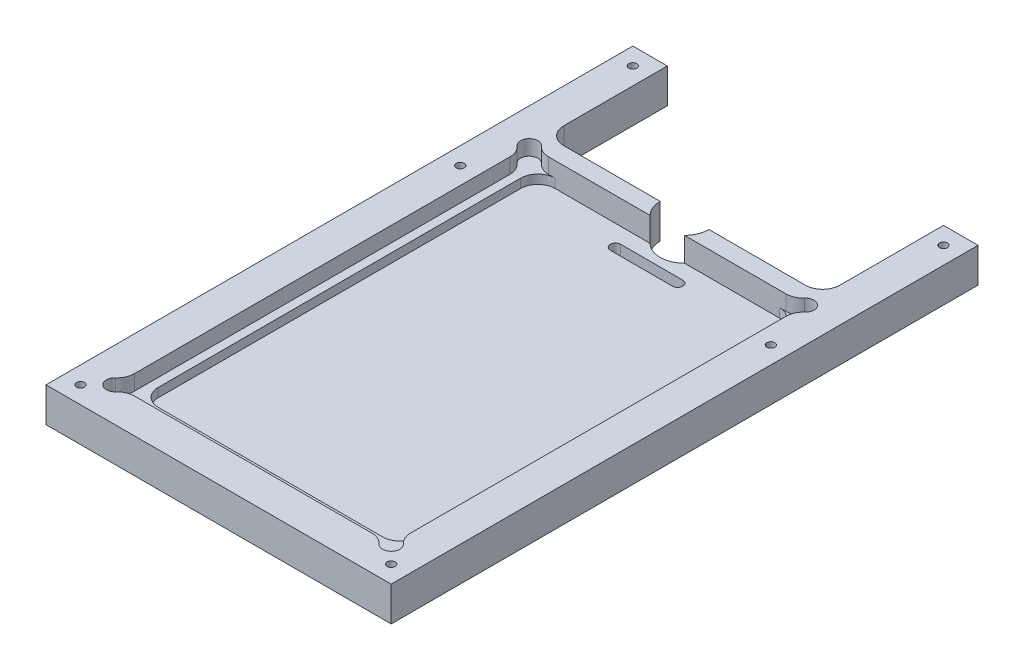
from build123d import *

# Parameters (mm, degrees)
SKETCH2_W                   = 127
SKETCH2_H                   = 215.9
BOSS_EXTRUDE1_DEPTH         = 12.7
SKETCH5_W                   = 101.6
SKETCH5_H                   = 152.4
CUT_EXTRUDE3_DEPTH          = 5.588
SKETCH6_W                   = 101.6
SKETCH6_H                   = 44.45
CUT_EXTRUDE4_DEPTH          = 251.804904258
SKETCH8_R                   = 8.980256121
CUT_EXTRUDE6_DEPTH          = 251.804904258
SKETCH9_W                   = 95.25
SKETCH9_H                   = 146.05
CUT_EXTRUDE7_DEPTH          = 3.302
CUT_EXTRUDE8_DEPTH          = 3.81
F_32_0_116_DIAMETER_HOLE1_D = 2.9464
SKETCH18_R                  = 3.175
CUT_EXTRUDE9_DEPTH          = 5.588
FILLET5_R                   = 6.35
FILLET7_R                   = 6.35
FILLET8_R                   = 6.35
FILLET10_R                  = 6.35
FILLET11_R                  = 6.35


with BuildPart() as part:
    # Sketch2 → Boss-Extrude1 (new body)
    with BuildSketch(Plane(origin=(0, 0, 0), x_dir=(1, 0, 0), z_dir=(0, 1, 0))):
        with Locations((63.5, 107.95)):
            Rectangle(SKETCH2_W, SKETCH2_H)
    extrude(amount=BOSS_EXTRUDE1_DEPTH)

    # Sketch5 → Cut-Extrude3 (cut)
    with BuildSketch(Plane(origin=(0, 12.7, 0), x_dir=(1, 0, 0), z_dir=(0, 1, 0))):
        with Locations((63.5, 88.9)):
            Rectangle(SKETCH5_W, SKETCH5_H)
    extrude(amount=-CUT_EXTRUDE3_DEPTH, mode=Mode.SUBTRACT)

    # Sketch6 → Cut-Extrude4 (cut, through all)
    with BuildSketch(Plane(origin=(0, 12.7, 0), x_dir=(1, 0, 0), z_dir=(0, 1, 0))):
        with Locations((63.5, 193.675)):
            Rectangle(SKETCH6_W, SKETCH6_H)
    extrude(amount=-CUT_EXTRUDE4_DEPTH, mode=Mode.SUBTRACT)

    # Sketch8 → Cut-Extrude6 (cut, through all)
    with BuildSketch(Plane(origin=(0, 12.7, 0), x_dir=(1, 0, 0), z_dir=(0, 1, 0))):
        with Locations((63.5, 171.45)):
            Circle(SKETCH8_R)
    extrude(amount=-CUT_EXTRUDE6_DEPTH, mode=Mode.SUBTRACT)

    # Sketch9 → Cut-Extrude7 (cut)
    with BuildSketch(Plane(origin=(0, 7.112, 0), x_dir=(1, 0, 0), z_dir=(0, 1, 0))):
        with Locations((63.5, 92.075)):
            Rectangle(SKETCH9_W, SKETCH9_H)
    extrude(amount=-CUT_EXTRUDE7_DEPTH, mode=Mode.SUBTRACT)

    # Sketch11 → Cut-Extrude8 (cut)
    with BuildSketch(Plane(origin=(0, 3.81, 0), x_dir=(1, 0, 0), z_dir=(0, 1, 0))):
        with BuildLine():
            Line((74.93, 155.575), (52.07, 155.575))
            ThreePointArc((52.07, 155.575), (50.165, 157.48), (52.07, 159.385))
            Line((52.07, 159.385), (74.93, 159.385))
            ThreePointArc((74.93, 159.385), (76.835, 157.48), (74.93, 155.575))
        make_face()
    extrude(amount=-CUT_EXTRUDE8_DEPTH, mode=Mode.SUBTRACT)

    # #32 (0.116) Diameter Hole1 (through all)
    with Locations(Plane(origin=(0, 12.7, 0), x_dir=(1, 0, 0), z_dir=(0, 1, 0))):
        with Locations((6.35, 209.55), (120.65, 209.55), (120.65, 6.35), (6.35, 6.35), (6.35, 146.05), (120.65, 146.05)):
            Hole(F_32_0_116_DIAMETER_HOLE1_D / 2)

    # Sketch18 → Cut-Extrude9 (cut)
    with BuildSketch(Plane(origin=(0, 12.7, 0), x_dir=(1, 0, 0), z_dir=(0, 1, 0))):
        with Locations((12.7, 165.1)):
            Circle(SKETCH18_R)
        with Locations((114.3, 165.1)):
            Circle(SKETCH18_R)
        with Locations((114.3, 12.7)):
            Circle(SKETCH18_R)
        with Locations((12.7, 12.7)):
            Circle(SKETCH18_R)
    extrude(amount=-CUT_EXTRUDE9_DEPTH, mode=Mode.SUBTRACT)

    # Fillet5
    fillet5_edges = [part.edges().sort_by_distance(p)[0] for p in [
        (12.7, 9.906, -15.875),
        (15.875, 9.906, -12.7),
        (114.3, 9.906, -15.875),
        (111.125, 9.906, -12.7),
        (111.125, 9.906, -165.1),
        (114.3, 9.906, -161.925),
        (15.875, 9.906, -165.1),
        (12.7, 9.906, -161.925),
    ]]
    fillet(fillet5_edges, radius=FILLET5_R)

    # Fillet7
    fillet7_edges = [part.edges().sort_by_distance(p)[0] for p in [
        (12.7, 6.35, -171.45),
        (114.3, 6.35, -171.45),
    ]]
    fillet(fillet7_edges, radius=FILLET7_R)

    # Fillet8
    fillet8_edges = [part.edges().sort_by_distance(p)[0] for p in [
        (15.875, 5.461, -19.05),
        (111.125, 5.461, -19.05),
    ]]
    fillet(fillet8_edges, radius=FILLET8_R)

    # Fillet10
    # the kernel refuses this fillet: 6.35 mm, written as the material it adds along each edge
    with BuildSketch(Plane(origin=(111.125, 7.112, -165.1), x_dir=(-1, 0, 0), z_dir=(0, -1, 0))) as fillet10_piece_1:
        with BuildLine():
            CenterArc((FILLET10_R, -FILLET10_R), FILLET10_R, 90, 90)
            Line((0, -FILLET10_R), (0, 0))
            Line((0, 0), (FILLET10_R, 0))
        make_face()
    extrude(amount=3.302)

    # Fillet11
    # the kernel refuses this fillet: 6.35 mm, written as the material it adds along each edge
    with BuildSketch(Plane(origin=(15.875, 7.112, -165.1), x_dir=(1, 0, 0), z_dir=(0, -1, 0))) as fillet11_piece_1:
        with BuildLine():
            CenterArc((FILLET11_R, FILLET11_R), FILLET11_R, 180, 90)
            Line((0, FILLET11_R), (0, 0))
            Line((0, 0), (FILLET11_R, 0))
        make_face()
    extrude(amount=3.302)


solid = part.part
